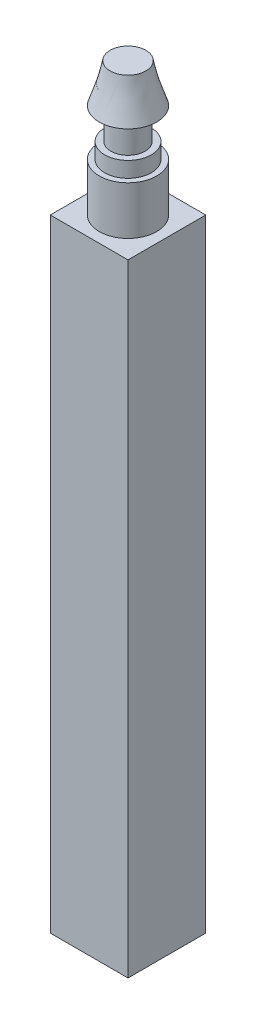
from build123d import *

# Parameters (mm, degrees)
SKETCH1_R           = 1.85
BOSS_EXTRUDE1_DEPTH = 3.1
SKETCH2_R           = 1.5
BOSS_EXTRUDE2_DEPTH = 1
SKETCH3_R           = 1.1
BOSS_EXTRUDE3_DEPTH = 2
SKETCH6_W           = 5
SKETCH6_H           = 5
BOSS_EXTRUDE4_DEPTH = 40
SKETCH7_R           = 1
CUT_EXTRUDE1_DEPTH  = 24


with BuildPart() as part:
    # Sketch1 → Boss-Extrude1 (new body)
    with BuildSketch(Plane(origin=(0, 0, 0), x_dir=(1, 0, 0), z_dir=(0, 1, 0))):
        with Locations(Location((0, 0, 0), (0, 0, 90))):
            Circle(SKETCH1_R)
    extrude(amount=BOSS_EXTRUDE1_DEPTH)

    # Sketch2 → Boss-Extrude2 (add)
    with BuildSketch(Plane(origin=(0, 3.1, 0), x_dir=(1, 0, 0), z_dir=(0, 1, 0))):
        with Locations(Location((0, 0, 0), (0, 0, 270))):
            Circle(SKETCH2_R)
    extrude(amount=BOSS_EXTRUDE2_DEPTH)

    # Sketch3 → Boss-Extrude3 (add)
    with BuildSketch(Plane(origin=(0, 4.1, 0), x_dir=(1, 0, 0), z_dir=(0, 1, 0))):
        with Locations(Location((0, 0, 0), (0, 0, 270))):
            Circle(SKETCH3_R)
    extrude(amount=BOSS_EXTRUDE3_DEPTH)

    # Loft1: read off the stored shape, not the designer's step
    # Loft1: loft between two sections, ruled curve by curve
    loft1_from = [
        Edge.make_bspline([(0, 6.1, 1.85), (3.7, 6.1, 1.85), (3.7, 6.1, -1.85), (0, 6.1, -1.85), (-3.7, 6.1, -1.85), (-3.7, 6.1, 1.85), (0, 6.1, 1.85)], [0, 0, 0, 0, 0.5, 0.5, 0.5, 1, 1, 1, 1], 3, [1, 0.333333333, 0.333333333, 1, 0.333333333, 0.333333333, 1]),
    ]
    loft1_to = [
        Edge.make_bspline([(0.620465421, 8.6, 0.968257539), (2.556980499, 8.6, -0.272673303), (1.316049657, 8.6, -2.209188381), (-0.620465421, 8.6, -0.968257539), (-2.556980499, 8.6, 0.272673303), (-1.316049657, 8.6, 2.209188381), (0.620465421, 8.6, 0.968257539)], [0, 0, 0, 0, 0.5, 0.5, 0.5, 1, 1, 1, 1], 3, [1, 0.333333333, 0.333333333, 1, 0.333333333, 0.333333333, 1]),
    ]
    loft1 = Solid(Shell([*[Face.make_surface_from_curves(loft1_from[k], loft1_to[k]) for k in range(1)], Face(Wire(loft1_from)), Face(Wire(loft1_to))]))
    add(loft1)

    # Sketch6 → Boss-Extrude4 (add)
    with BuildSketch(Plane.XZ):
        Rectangle(SKETCH6_W, SKETCH6_H)
    extrude(amount=BOSS_EXTRUDE4_DEPTH)

    # Sketch7 → Cut-Extrude1 (cut)
    with BuildSketch(Plane.XZ.offset(40)):
        with Locations(Location((0, 0, 0), (0, 0, 270))):
            Circle(SKETCH7_R)
    extrude(amount=-CUT_EXTRUDE1_DEPTH, mode=Mode.SUBTRACT)


solid = part.part
